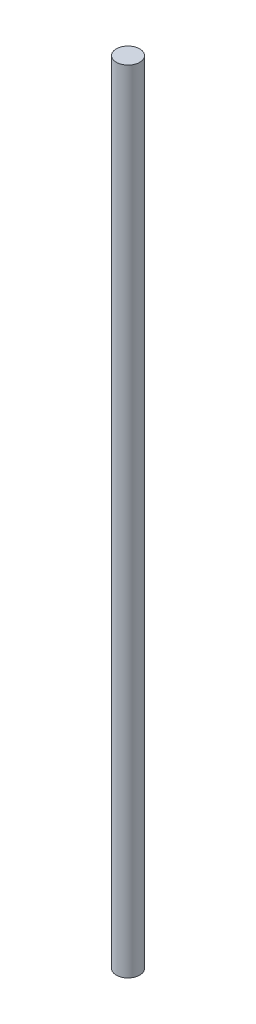
from build123d import *

# Parameters (mm, degrees)
SCHIZZO1_R                   = 1.243400346
ESTRUSIONE_ESTRUSIONE1_DEPTH = 84.07344072


# Read off the part's stored shape, not the designer's step: DjiGps.stp
with BuildPart() as part:
    # Schizzo1 → Estrusione-Estrusione1 (new body)
    with BuildSketch(Plane.XZ.offset(5)):
        with Locations(Location((0, -1.243400346, 0), (0, 0, 270))):
            Circle(SCHIZZO1_R)
    extrude(amount=-ESTRUSIONE_ESTRUSIONE1_DEPTH)


solid = part.part
